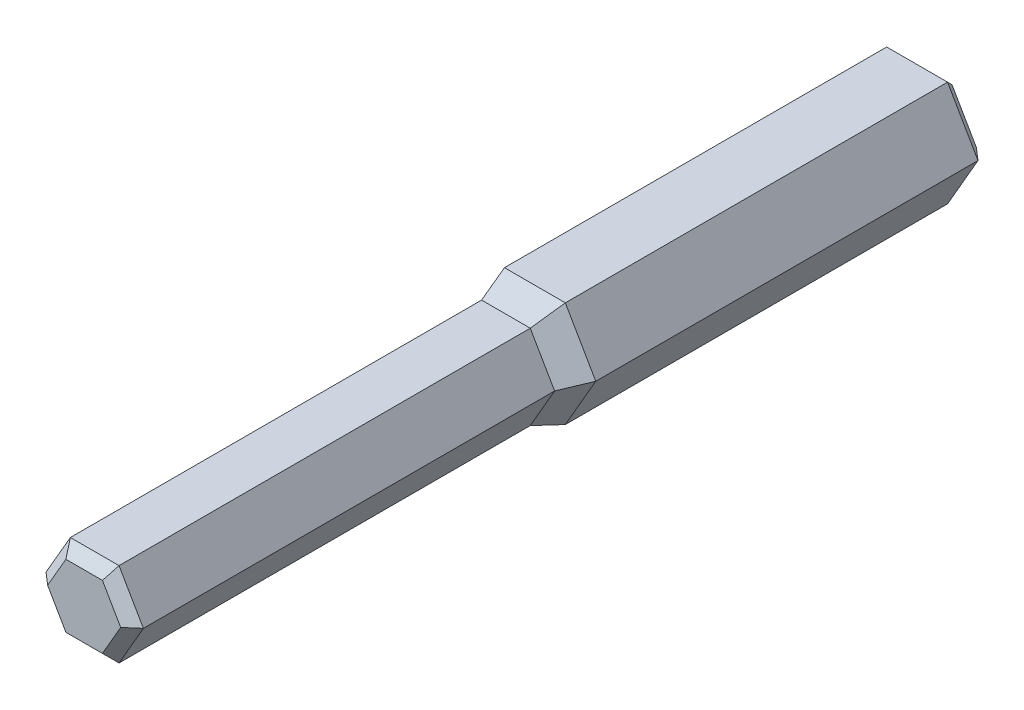
from build123d import *
from OCP.BRepFilletAPI import BRepFilletAPI_MakeChamfer

# Parameters (mm, degrees)
EXTRUDE_1_DEPTH  = 20
CHAMFER_1_SIZE   = 0.5
EXTRUDE_2_DEPTH  = 20
CHAMFER_3_SIZE   = 1.37373871
CHAMFER_3_SIZE_2 = 0.5
CHAMFER_4_SIZE   = 0.5


with BuildPart() as part:
    # 草图1 → 凸台-拉伸1 (new body)
    with BuildSketch(Plane.XY):
        Polygon((2.309401077, 0), (1.154700538, 2), (-1.154700538, 2), (-2.309401077, 0), (-1.154700538, -2), (1.154700538, -2), align=None)
    extrude(amount=EXTRUDE_1_DEPTH)

    # 倒角1
    chamfer_1_edges = [part.edges().sort_by_distance(p)[0] for p in [
        (0, 2, 20),
        (-1.732050808, 1, 20),
        (-1.732050808, -1, 20),
        (0, -2, 20),
        (1.732050808, -1, 20),
        (1.732050808, 1, 20),
    ]]
    chamfer(chamfer_1_edges, length=CHAMFER_1_SIZE)

    # 草图2 → 凸台-拉伸2 (add)
    with BuildSketch(Plane(origin=(0, 0, 0), x_dir=(-1, 0, 0), z_dir=(0, 0, -1))):
        Polygon((2.886751346, 0), (1.443375673, 2.5), (-1.443375673, 2.5), (-2.886751346, 0), (-1.443375673, -2.5), (1.443375673, -2.5), align=None)
    extrude(amount=EXTRUDE_2_DEPTH)

    # 倒角3
    chamfer_3_edges_1 = [part.edges().sort_by_distance(p)[0] for p in [
        (-2.165063509, -1.25, 0),
    ]]
    chamfer_3_side_1 = [part.faces().sort_by_distance(p)[0] for p in [
        (-2.165063509, -1.25, -0.01),
    ]]
    chamfer_3_edges_2 = [part.edges().sort_by_distance(p)[0] for p in [
        (-2.165063509, 1.25, 0),
    ]]
    chamfer_3_side_2 = [part.faces().sort_by_distance(p)[0] for p in [
        (-2.165063509, 1.25, -0.01),
    ]]
    chamfer_3_edges_3 = [part.edges().sort_by_distance(p)[0] for p in [
        (0, 2.5, 0),
    ]]
    chamfer_3_side_3 = [part.faces().sort_by_distance(p)[0] for p in [
        (0, 2.5, -0.01),
    ]]
    chamfer_3_edges_4 = [part.edges().sort_by_distance(p)[0] for p in [
        (2.165063509, 1.25, 0),
    ]]
    chamfer_3_side_4 = [part.faces().sort_by_distance(p)[0] for p in [
        (2.156403255, 1.245, 0),
    ]]
    chamfer_3_edges_5 = [part.edges().sort_by_distance(p)[0] for p in [
        (2.165063509, -1.25, 0),
    ]]
    chamfer_3_side_5 = [part.faces().sort_by_distance(p)[0] for p in [
        (2.156403255, -1.245, 0),
    ]]
    chamfer_3_edges_6 = [part.edges().sort_by_distance(p)[0] for p in [
        (0, -2.5, 0),
    ]]
    chamfer_3_side_6 = [part.faces().sort_by_distance(p)[0] for p in [
        (0, -2.49, 0),
    ]]
    chamfer_3 = BRepFilletAPI_MakeChamfer(part.part.solid().wrapped)
    for e in chamfer_3_edges_1:
        chamfer_3.Add(CHAMFER_3_SIZE - 0.0001, CHAMFER_3_SIZE_2 - 0.0001, e.wrapped, chamfer_3_side_1[0].wrapped)
    for e in chamfer_3_edges_2:
        chamfer_3.Add(CHAMFER_3_SIZE - 0.0001, CHAMFER_3_SIZE_2 - 0.0001, e.wrapped, chamfer_3_side_2[0].wrapped)
    for e in chamfer_3_edges_3:
        chamfer_3.Add(CHAMFER_3_SIZE - 0.0001, CHAMFER_3_SIZE_2 - 0.0001, e.wrapped, chamfer_3_side_3[0].wrapped)
    for e in chamfer_3_edges_4:
        chamfer_3.Add(CHAMFER_3_SIZE_2 - 0.0001, CHAMFER_3_SIZE - 0.0001, e.wrapped, chamfer_3_side_4[0].wrapped)
    for e in chamfer_3_edges_5:
        chamfer_3.Add(CHAMFER_3_SIZE_2 - 0.0001, CHAMFER_3_SIZE - 0.0001, e.wrapped, chamfer_3_side_5[0].wrapped)
    for e in chamfer_3_edges_6:
        chamfer_3.Add(CHAMFER_3_SIZE_2 - 0.0001, CHAMFER_3_SIZE - 0.0001, e.wrapped, chamfer_3_side_6[0].wrapped)
    add(Compound.cast(chamfer_3.Shape()), mode=Mode.REPLACE)  # a hair under: the kernel refuses the full size

    # 倒角4
    chamfer_4_edges = [part.edges().sort_by_distance(p)[0] for p in [
        (-2.165063509, -1.25, -20),
        (-2.165063509, 1.25, -20),
        (0, 2.5, -20),
        (2.165063509, 1.25, -20),
        (2.165063509, -1.25, -20),
        (0, -2.5, -20),
    ]]
    chamfer(chamfer_4_edges, length=CHAMFER_4_SIZE)


solid = part.part
